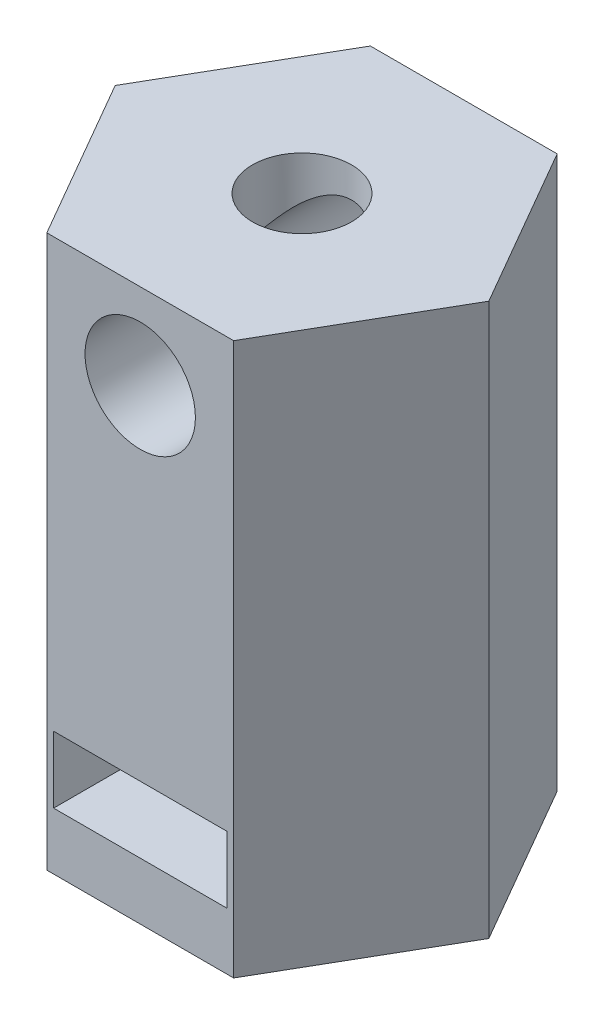
from build123d import *
from build123d.topology import SkipClean

# Parameters (mm, degrees)
SKETCH2_R           = 2.6
CORE_DEPTH          = 12
HEX_NUT_DEPTH       = 14.2
BOLT_GUARD_DEPTH    = 2
SKETCH7_R           = 2.6
D_SHAFT_DEPTH       = 15
SET_SCREW_DEPTH     = 36.019042439
BOSS_EXTRUDE1_REACH = 27.978


with BuildPart() as part:
    # Sketch2 → core (new body)
    with BuildSketch(Plane(origin=(0, 0, 0), x_dir=(1, 0, 0), z_dir=(0, 1, 0))):
        Polygon((9.814954576, 0), (4.907477288, 8.5), (-4.907477288, 8.5), (-9.814954576, 0), (-4.907477288, -8.5), (4.907477288, -8.5), align=None)
        Circle(SKETCH2_R, mode=Mode.SUBTRACT)
    extrude(amount=CORE_DEPTH)

    # Sketch5 → hex-nut (cut)
    with BuildSketch(Plane.XY.offset(8.5)):
        Polygon((0, 3), (4.55, 3), (4.55, 6.5), (-4.55, 6.5), (-4.55, 3), align=None)
    extrude(amount=-HEX_NUT_DEPTH, mode=Mode.SUBTRACT)

    # Sketch4 → bolt-guard (add)
    with BuildSketch(Plane(origin=(0, 12, 0), x_dir=(1, 0, 0), z_dir=(0, 1, 0))):
        Polygon((9.814954576, 0), (4.907477288, 8.5), (-4.907477288, 8.5), (-9.814954576, 0), (-4.907477288, -8.5), (4.907477288, -8.5), align=None)
    extrude(amount=BOLT_GUARD_DEPTH)

    # Sketch7 → d-shaft (add)
    with BuildSketch(Plane(origin=(0, 14, 0), x_dir=(1, 0, 0), z_dir=(0, 1, 0))):
        Polygon((9.814954576, 0), (4.907477288, 8.5), (-4.907477288, 8.5), (-9.814954576, 0), (-4.907477288, -8.5), (4.907477288, -8.5), align=None)
        Circle(SKETCH7_R, mode=Mode.SUBTRACT)
    extrude(amount=D_SHAFT_DEPTH)

    # Sketch8 → set-screw (cut, through all)
    with SkipClean():  # the faces are left unmerged after this step: merging them gives an invalid solid
        with BuildSketch(Plane.XY.offset(8.5)):
            with BuildLine():
                ThreePointArc((0, 27.4), (-2.050609665, 22.449390335), (2.9, 24.5))
                ThreePointArc((2.9, 24.5), (2.050609665, 26.550609665), (0, 27.4))
            make_face()
        extrude(amount=-SET_SCREW_DEPTH, mode=Mode.SUBTRACT)

    # Sketch9 → Boss-Extrude1 (add, up to next)
    with BuildSketch(Plane.XZ.offset(-6.5), mode=Mode.PRIVATE) as boss_extrude1_sk1:
        Polygon((4.55, -5.7), (4.55, 0), (2.275, -3.940415587), (-2.275, -3.940415587), (-4.55, 0), (-4.55, -5.7), align=None)
    boss_extrude1_tool1 = extrude(boss_extrude1_sk1.sketch, amount=BOSS_EXTRUDE1_REACH, mode=Mode.PRIVATE) - part.part
    add(boss_extrude1_tool1.solids().sort_by_distance((0, 6.5, -4.033017))[0])


solid = part.part
